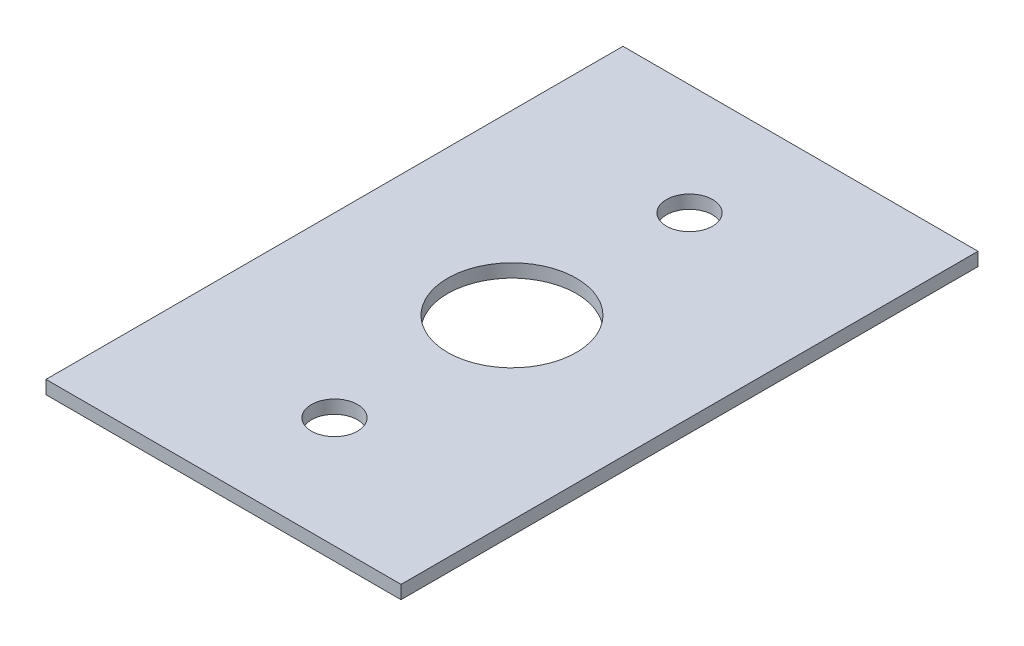
from build123d import *

# Parameters (mm, degrees)
ESQUISSE1_W               = 40
ESQUISSE1_H               = 65
T_LE_DE_BASE_PLI_E1_DEPTH = 1.5
PASSAGE_VIS_M5_REACH      = 40.19
ESQUISSE6_R               = 2.6
PASSAGE_JAUGE_REACH       = 40.19
ESQUISSE7_R               = 7.25


# Sheet-metal steps are written as plain solids
with BuildPart() as part:
    # Esquisse1 → Tôle de base pliée1 (new body)
    with BuildSketch(Plane(origin=(0, 0, 0), x_dir=(1, 0, 0), z_dir=(0, 1, 0))):
        Rectangle(ESQUISSE1_W, ESQUISSE1_H)
    extrude(amount=-T_LE_DE_BASE_PLI_E1_DEPTH)

    # Esquisse6 → Passage_Vis_M5 (cut, up to next)
    with BuildSketch(Plane(origin=(0, 0, 0), x_dir=(1, 0, 0), z_dir=(0, 1, 0)), mode=Mode.PRIVATE) as passage_vis_m5_sk1:
        with Locations(Location((0, 20, 0), (0, 0, 270))):
            Circle(ESQUISSE6_R)
    passage_vis_m5_tool1 = extrude(passage_vis_m5_sk1.sketch, amount=-PASSAGE_VIS_M5_REACH, mode=Mode.PRIVATE) & part.part
    # Esquisse6 → Passage_Vis_M5 (cut, up to next)
    with BuildSketch(Plane(origin=(0, 0, 0), x_dir=(1, 0, 0), z_dir=(0, 1, 0)), mode=Mode.PRIVATE) as passage_vis_m5_sk2:
        with Locations(Location((0, -20, 0), (0, 0, 90))):
            Circle(ESQUISSE6_R)
    passage_vis_m5_tool2 = extrude(passage_vis_m5_sk2.sketch, amount=-PASSAGE_VIS_M5_REACH, mode=Mode.PRIVATE) & part.part
    add(passage_vis_m5_tool1.solids().sort_by_distance((0, 0, -20))[0], mode=Mode.SUBTRACT)
    add(passage_vis_m5_tool2.solids().sort_by_distance((0, 0, 20))[0], mode=Mode.SUBTRACT)

    # Esquisse7 → Passage_Jauge (cut, up to next)
    with BuildSketch(Plane(origin=(0, 0, 0), x_dir=(1, 0, 0), z_dir=(0, 1, 0)), mode=Mode.PRIVATE) as passage_jauge_sk1:
        with Locations(Location((0, 0, 0), (0, 0, 270))):
            Circle(ESQUISSE7_R)
    passage_jauge_tool1 = extrude(passage_jauge_sk1.sketch, amount=-PASSAGE_JAUGE_REACH, mode=Mode.PRIVATE) & part.part
    add(passage_jauge_tool1.solids().sort_by_distance((0, 0, 0))[0], mode=Mode.SUBTRACT)


solid = part.part
